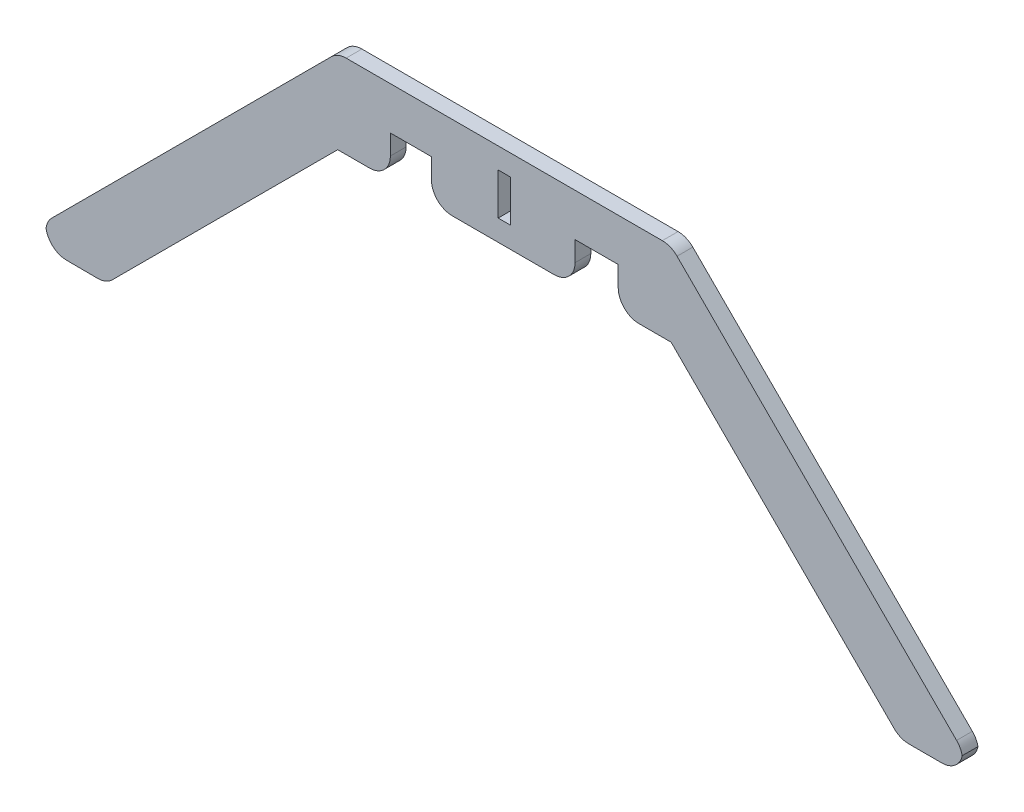
from build123d import *

# Parameters (mm, degrees)
SKETCH1_W           = 279.4
SKETCH1_H           = 254
BOSS_EXTRUDE1_DEPTH = 4.800000052
SKETCH4_W           = 13.148347957
SKETCH4_H           = 12.442555781
SKETCH4_W_2         = 3.81
SKETCH4_H_2         = 12.7
SKETCH4_W_3         = 12.512633495
CUT_EXTRUDE1_DEPTH  = 378.628653575
FILLET1_R           = 6.35


with BuildPart() as part:
    # Sketch1 → Boss-Extrude1 (new body)
    with BuildSketch(Plane.XY):
        with Locations((139.7, 127)):
            Rectangle(SKETCH1_W, SKETCH1_H)
    extrude(amount=BOSS_EXTRUDE1_DEPTH)

    # Sketch4 → Cut-Extrude1 (cut, through all)
    with BuildSketch(Plane(origin=(0, 0, 0), x_dir=(-1, 0, 0), z_dir=(0, 0, -1))):
        Polygon((0, 0), (0, 72.835400266), (-18.411229684, 72.724077305), (-88.95741747, 143.27026509), (-105.001094941, 143.27026509), (-117.513728436, 143.27026509), (-161.28323771, 143.27026509), (-174.431585667, 143.27026509), (-190.55741747, 143.27026509), (-260.35, 73.47768256), (-279.4, 73.47768256), (-279.4, 0), align=None)
        Polygon((-88.9, 168.72768256), (0, 79.82768256), (0, 254), (-279.4, 254), (-279.4, 79.82768256), (-190.5, 168.72768256), align=None)
        with Locations((-167.857411689, 149.491542981)):
            Rectangle(SKETCH4_W, SKETCH4_H)
        with Locations((-139.75741747, 156.02768256)):
            Rectangle(SKETCH4_W_2, SKETCH4_H_2)
        with Locations((-111.257411689, 149.491542981)):
            Rectangle(SKETCH4_W_3, SKETCH4_H)
    extrude(amount=-CUT_EXTRUDE1_DEPTH, mode=Mode.SUBTRACT)

    # Fillet1
    # the kernel refuses this fillet: 6.35 mm, written as the material it takes off along each edge
    with BuildSketch(Plane(origin=(105.001094941, 143.27026509, -15.875), x_dir=(0, 1, 0), z_dir=(0, 0, 1)), Plane(origin=(279.4, 73.47768256, -15.875), x_dir=(0, 1, 0), z_dir=(0, 0, 1)), Plane(origin=(174.431585667, 143.27026509, -15.875), x_dir=(1, 0, 0), z_dir=(0, 0, 1)), Plane(origin=(161.28323771, 143.27026509, -15.875), x_dir=(0, 1, 0), z_dir=(0, 0, 1)), Plane(origin=(117.513728436, 143.27026509, -15.875), x_dir=(1, 0, 0), z_dir=(0, 0, 1))) as fillet1_piece_1:
        with BuildLine():
            CenterArc((FILLET1_R, FILLET1_R), FILLET1_R, 180, 90)
            Line((0, FILLET1_R), (0, 0))
            Line((0, 0), (FILLET1_R, 0))
        make_face()
    extrude(amount=36.550000052, mode=Mode.SUBTRACT)
    with BuildSketch(Plane(origin=(18.411229684, 72.724077305, -6.631938595), x_dir=(-0.9999817205970539, 0.006046360207229539, 0), z_dir=(0, 0, 1))) as fillet1_piece_2:
        with BuildLine():
            CenterArc((FILLET1_R * 0.41775991148, -FILLET1_R), FILLET1_R, 90, 45.346433032)
            Line((-FILLET1_R * 0.293609366521, -FILLET1_R * 0.297181566607), (0, 0))
            Line((0, 0), (FILLET1_R * 0.41775991148, 0))
        make_face()
    extrude(amount=18.063877241, mode=Mode.SUBTRACT)
    with BuildSketch(Plane(origin=(0, 72.835400266, -15.779302468), x_dir=(0, 1, 0), z_dir=(0, 0, 1))) as fillet1_piece_3:
        with BuildLine():
            CenterArc((FILLET1_R * 0.993971809004, -FILLET1_R), FILLET1_R, 90, 89.653566968)
            Line((-FILLET1_R * 0.00600991159307, -FILLET1_R * 0.993953639793), (0, 0))
            Line((0, 0), (FILLET1_R * 0.993971809004, 0))
        make_face()
    extrude(amount=36.358604988, mode=Mode.SUBTRACT)
    with BuildSketch(Plane(origin=(260.35, 73.47768256, -6.575640303), x_dir=(1, 0, 0), z_dir=(0, 0, 1)), Plane(origin=(190.5, 168.72768256, -6.575640303), x_dir=(-1, 0, 0), z_dir=(0, 0, 1)), Plane(origin=(279.4, 79.82768256, -6.575640303), x_dir=(-0.7071067811865475, 0.7071067811865475, 0), z_dir=(0, 0, 1)), Plane(origin=(0, 79.82768256, -6.575640303), x_dir=(0, -1, 0), z_dir=(0, 0, 1)), Plane(origin=(88.9, 168.72768256, -6.575640303), x_dir=(-0.7071067811865476, -0.7071067811865476, 0), z_dir=(0, 0, 1))) as fillet1_piece_4:
        with BuildLine():
            CenterArc((FILLET1_R * 0.414213562373, FILLET1_R), FILLET1_R, 225, 45)
            Line((-FILLET1_R * 0.292893218813, FILLET1_R * 0.292893218813), (0, 0))
            Line((0, 0), (FILLET1_R * 0.414213562373, 0))
        make_face()
    extrude(amount=17.951280657, mode=Mode.SUBTRACT)


solid = part.part
